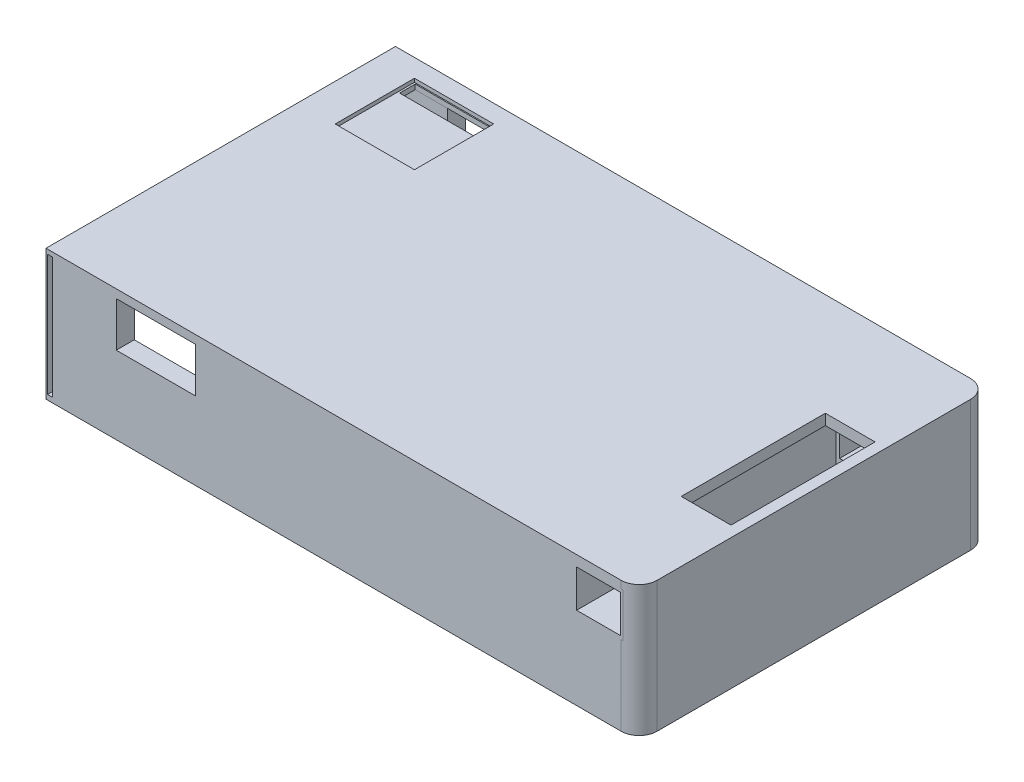
from build123d import *
from build123d.topology import SkipClean

# Parameters (mm, degrees)
CROQUIS1_W              = 114
CROQUIS1_H              = 34.2
SALIENTE_EXTRUIR1_DEPTH = 97
VACIADO1_T              = -5
SALIENTE_EXTRUIR2_DEPTH = 97
CORTAR_EXTRUIR1_REACH   = 128.031
CROQUIS3_W              = 13.814275766
CROQUIS3_H              = 40
REDONDEO2_R             = 5
CROQUIS6_W              = 12.3
CROQUIS6_H              = 10.4
CORTAR_EXTRUIR3_DEPTH   = 124.459670354
SALIENTE_EXTRUIR3_DEPTH = 97
CROQUIS8_W              = 13.814275766
CROQUIS8_H              = 40
CORTAR_EXTRUIR4_DEPTH   = 127.030661617
CROQUIS9_W              = 104
CROQUIS9_H              = 87
CORTAR_EXTRUIR5_DEPTH   = 10
CORTAR_EXTRUIR6_START   = -33.316303
CROQUIS11_W             = 1.5
CROQUIS11_H             = 39.999512223
CROQUIS11_H_2           = 40
CORTAR_EXTRUIR6_DEPTH   = 33.316303
CORTAR_EXTRUIR7_START   = -33.316303
CROQUIS13_W             = 15.314275766
CROQUIS13_H             = 4.5
CORTAR_EXTRUIR7_DEPTH   = 33.316303
CROQUIS14_W             = 40
CROQUIS14_H             = 2.980218128
SALIENTE_EXTRUIR4_DEPTH = 15.498885391
CORTAR_EXTRUIR8_DEPTH   = 20.498885391
CROQUIS19_W             = 5
CROQUIS19_H             = 21.536410229
CROQUIS19_H_2           = 2.349460024
SALIENTE_EXTRUIR5_DEPTH = 22
CROQUIS20_W             = 5
CROQUIS20_H             = 36.296521374
SALIENTE_EXTRUIR6_DEPTH = 19.5
CROQUIS21_W             = 87
CROQUIS21_H             = 2.349460024
SALIENTE_EXTRUIR7_DEPTH = 144.815390375
CROQUIS23_W             = 1.39816901
CROQUIS23_H             = 33.700902132
CORTAR_EXTRUIR9_DEPTH   = 95.5
CROQUIS24_W             = 22.493754325
CROQUIS24_H             = 22.211308676
CORTAR_EXTRUIR10_DEPTH  = 1.5
CROQUIS25_W             = 5.544572311
CROQUIS25_H             = 16.748281631
CORTAR_EXTRUIR11_DEPTH  = 1.5
SALIENTE_EXTRUIR8_DEPTH = 46
CROQUIS27_W             = 22
CROQUIS27_H             = 22
CORTAR_EXTRUIR12_DEPTH  = 1
CROQUIS28_W             = 21.106040847
CROQUIS28_H             = 4.330702007
CORTAR_EXTRUIR14_DEPTH  = 1.5


with BuildPart() as part:
    # Croquis1 → Saliente-Extruir1 (new body)
    with BuildSketch(Plane.XY):
        with Locations((0, -8.9)):
            Rectangle(CROQUIS1_W, CROQUIS1_H)
    extrude(amount=-SALIENTE_EXTRUIR1_DEPTH)

    # Vaciado1
    vaciado1_openings = [part.faces().sort_by_distance(p)[0] for p in [
        (0, -26, -48.5),
    ]]
    offset(amount=VACIADO1_T, openings=vaciado1_openings, kind=Kind.INTERSECTION)

    # Croquis2 → Saliente-Extruir2 (add, through all)
    with BuildSketch(Plane(origin=(0, 0, -97), x_dir=(-1, 0, 0), z_dir=(0, 0, -1))):
        Polygon((71.814275766, 8.2), (67.33466189, 8.2), (67.33466189, -3.967393508), (57, -3.967393508), (57, -26), (67.33466189, -26), (71.814275766, -26), align=None)
        Polygon((-57, 8.2), (57, 8.2), (67.33466189, 8.2), (71.814275766, 8.2), (71.814275766, 10.296521374), (-71.814275766, 10.296521374), (-71.814275766, 8.2), (-67.33466189, 8.2), align=None)
        Polygon((-67.33466189, -3.967393508), (-67.33466189, 8.2), (-71.814275766, 8.2), (-71.814275766, -26), (-67.33466189, -26), (-57, -26), (-57, -3.967393508), align=None)
    extrude(amount=-SALIENTE_EXTRUIR2_DEPTH)

    # Croquis3 → Cortar-Extruir1 (cut, up to next)
    with BuildSketch(Plane.XZ.offset(26), mode=Mode.PRIVATE) as cortar_extruir1_sk1:
        with Locations((-61.907137883, -48.5)):
            Rectangle(CROQUIS3_W, CROQUIS3_H)
    cortar_extruir1_tool1 = extrude(cortar_extruir1_sk1.sketch, amount=-CORTAR_EXTRUIR1_REACH, mode=Mode.PRIVATE) & part.part
    # Croquis3 → Cortar-Extruir1 (cut, up to next)
    with BuildSketch(Plane.XZ.offset(26), mode=Mode.PRIVATE) as cortar_extruir1_sk2:
        with Locations((61.907137883, -48.5)):
            Rectangle(CROQUIS3_W, CROQUIS3_H)
    cortar_extruir1_tool2 = extrude(cortar_extruir1_sk2.sketch, amount=-CORTAR_EXTRUIR1_REACH, mode=Mode.PRIVATE) & part.part
    add(cortar_extruir1_tool1.solids().sort_by_distance((-61.907138, -26, -48.5))[0], mode=Mode.SUBTRACT)
    add(cortar_extruir1_tool2.solids().sort_by_distance((61.907138, -26, -48.5))[0], mode=Mode.SUBTRACT)

    # Redondeo2
    # the kernel refuses this fillet: 5 mm, written as the material it takes off along each edge
    with BuildSketch(Plane(origin=(71.814275766, -38.5, -97), x_dir=(0, 0, 1), z_dir=(0, 1, 0)), Plane(origin=(71.814275766, -38.5, 0), x_dir=(-1, 0, 0), z_dir=(0, 1, 0)), Plane(origin=(-71.814275766, 22.796521374, -97), x_dir=(0, 0, 1), z_dir=(0, -1, 0)), Plane(origin=(-71.814275766, 22.796521374, 0), x_dir=(1, 0, 0), z_dir=(0, -1, 0))) as redondeo2_piece_1:
        with BuildLine():
            CenterArc((REDONDEO2_R, -REDONDEO2_R), REDONDEO2_R, 90, 90)
            Line((0, -REDONDEO2_R), (0, 0))
            Line((0, 0), (REDONDEO2_R, 0))
        make_face()
    extrude(amount=61.296521374, mode=Mode.SUBTRACT)

    # Croquis6 → Cortar-Extruir3 (cut, through all)
    with BuildSketch(Plane(origin=(0, 0, -97), x_dir=(-1, 0, 0), z_dir=(0, 0, -1))):
        with Locations((-60.617330945, 2.116303246)):
            Rectangle(CROQUIS6_W, CROQUIS6_H)
        with Locations((60.617330945, 2.116303246)):
            Rectangle(CROQUIS6_W, CROQUIS6_H)
    extrude(amount=-CORTAR_EXTRUIR3_DEPTH, mode=Mode.SUBTRACT)

    # Croquis7 → Saliente-Extruir3 (add, through all)
    with BuildSketch(Plane(origin=(0, 0, -97), x_dir=(-1, 0, 0), z_dir=(0, 0, -1))):
        Polygon((57, 8.2), (57, 7.316303246), (66.667330945, 7.316303246), (66.667330945, -3.083696754), (57, -3.083696754), (57, -3.967393508), (66.814275766, -3.967393508), (67.33466189, -3.967393508), (67.33466189, 8.2), (66.814275766, 8.2), align=None)
        Polygon((-66.667330945, 7.32503221), (-57, 7.32503221), (-57, 8.2), (-66.814275766, 8.2), (-67.33466189, 8.2), (-67.33466189, -3.967393508), (-66.814275766, -3.967393508), (-57, -3.967393508), (-57, -3.083696754), (-66.667330945, -3.083696754), align=None)
    extrude(amount=-SALIENTE_EXTRUIR3_DEPTH)

    # Croquis8 → Cortar-Extruir4 (cut, through all)
    with BuildSketch(Plane(origin=(0, 10.296521374, 0), x_dir=(1, 0, 0), z_dir=(0, 1, 0))):
        with Locations((-61.907137883, 48.5)):
            Rectangle(CROQUIS8_W, CROQUIS8_H)
        with Locations((61.907137883, 48.5)):
            Rectangle(CROQUIS8_W, CROQUIS8_H)
    extrude(amount=-CORTAR_EXTRUIR4_DEPTH, mode=Mode.SUBTRACT)

    # Croquis9 → Cortar-Extruir5 (cut)
    with BuildSketch(Plane.XZ.offset(-3.2)):
        with Locations((0, -48.5)):
            Rectangle(CROQUIS9_W, CROQUIS9_H)
    extrude(amount=-CORTAR_EXTRUIR5_DEPTH, mode=Mode.SUBTRACT)

    # Croquis11 → Cortar-Extruir6 (cut)
    with SkipClean():  # the faces are left unmerged after this step: merging them gives an invalid solid
        with BuildSketch(Plane.XZ.offset(26).offset(CORTAR_EXTRUIR6_START)):
            with Locations((54.25, -48.499756112)):
                Rectangle(CROQUIS11_W, CROQUIS11_H)
            with Locations((-54.25, -48.5)):
                Rectangle(CROQUIS11_W, CROQUIS11_H_2)
        extrude(amount=CORTAR_EXTRUIR6_DEPTH, mode=Mode.SUBTRACT)

    # Croquis13 → Cortar-Extruir7 (cut)
    with BuildSketch(Plane.XZ.offset(26).offset(CORTAR_EXTRUIR7_START)):
        with Locations((-61.157137883, -26.25)):
            Rectangle(CROQUIS13_W, CROQUIS13_H)
        with Locations((-61.157137883, -70.75)):
            Rectangle(CROQUIS13_W, CROQUIS13_H)
        with Locations((61.157137883, -26.25)):
            Rectangle(CROQUIS13_W, CROQUIS13_H)
        with Locations((61.157137883, -70.749512223)):
            Rectangle(CROQUIS13_W, CROQUIS13_H)
    extrude(amount=CORTAR_EXTRUIR7_DEPTH, mode=Mode.SUBTRACT)

    # Croquis14 → Saliente-Extruir4 (add)
    with BuildSketch(Plane.ZY.offset(55)):
        with Locations((-48.5, 8.80641231)):
            Rectangle(CROQUIS14_W, CROQUIS14_H)
    extrude(amount=SALIENTE_EXTRUIR4_DEPTH)

    # Croquis16 → Cortar-Extruir8 (cut)
    with BuildSketch(Plane.ZY.offset(71.814275766)):
        Polygon((-5, 10.296521374), (-98.41592061, 10.296521374), (-98.41592061, -27.13789471), (0, -27.13789471), (0, 10.296521374), align=None)
    extrude(amount=-CORTAR_EXTRUIR8_DEPTH, mode=Mode.SUBTRACT)

    # Croquis19 → Saliente-Extruir5 (add)
    with BuildSketch(Plane.ZY.offset(51.315390375)):
        with Locations((-2.5, -15.231794886)):
            Rectangle(CROQUIS19_W, CROQUIS19_H)
        with Locations((-94.5, -15.231794886)):
            Rectangle(CROQUIS19_W, CROQUIS19_H)
        with Locations((-2.5, 9.121791362)):
            Rectangle(CROQUIS19_W, CROQUIS19_H_2)
        with Locations((-94.5, 9.121791362)):
            Rectangle(CROQUIS19_W, CROQUIS19_H_2)
    extrude(amount=SALIENTE_EXTRUIR5_DEPTH)

    # Croquis20 → Saliente-Extruir6 (add)
    with BuildSketch(Plane.ZY.offset(73.315390375)):
        with Locations((-2.5, -7.851739313)):
            Rectangle(CROQUIS20_W, CROQUIS20_H)
        with Locations((-94.5, -7.851739313)):
            Rectangle(CROQUIS20_W, CROQUIS20_H)
    extrude(amount=SALIENTE_EXTRUIR6_DEPTH)

    # Croquis21 → Saliente-Extruir7 (add)
    with BuildSketch(Plane.ZY.offset(-52)):
        with Locations((-48.5, 9.121791362)):
            Rectangle(CROQUIS21_W, CROQUIS21_H)
    extrude(amount=SALIENTE_EXTRUIR7_DEPTH)

    # Croquis23 → Cortar-Extruir9 (cut)
    with BuildSketch(Plane.XY):
        with Locations((-91.682194084, -7.778032427)):
            Rectangle(CROQUIS23_W, CROQUIS23_H)
    extrude(amount=-CORTAR_EXTRUIR9_DEPTH, mode=Mode.SUBTRACT)

    # Croquis24 → Cortar-Extruir10 (cut)
    with BuildSketch(Plane(origin=(0, 10.296521374, 0), x_dir=(1, 0, 0), z_dir=(0, 1, 0))):
        with Locations((-78.515448222, 48.5)):
            Rectangle(CROQUIS24_W, CROQUIS24_H)
    extrude(amount=-CORTAR_EXTRUIR10_DEPTH, mode=Mode.SUBTRACT)

    # Croquis25 → Cortar-Extruir11 (cut)
    with BuildSketch(Plane(origin=(0, 8.796521374, 0), x_dir=(1, 0, 0), z_dir=(0, 1, 0))):
        with Locations((-86.990039229, 48.639589487)):
            Rectangle(CROQUIS25_W, CROQUIS25_H)
    extrude(amount=-CORTAR_EXTRUIR11_DEPTH, mode=Mode.SUBTRACT)

    # Croquis26 → Saliente-Extruir8 (add)
    with BuildSketch(Plane(origin=(-89.762325384, 0, 0), x_dir=(0, 0, -1), z_dir=(1, 0, 0))):
        Polygon((59.605654338, 10.296521374), (37.394345662, 10.296521374), (37.394345662, 8.796521374), (40.265448671, 8.796521374), (40.265448671, 7.94706135), (57.013730302, 7.94706135), (57.013730302, 8.796521374), (59.605654338, 8.796521374), align=None)
    extrude(amount=SALIENTE_EXTRUIR8_DEPTH)

    # Croquis27 → Cortar-Extruir12 (cut)
    with BuildSketch(Plane(origin=(0, 10.296521374, 0), x_dir=(1, 0, 0), z_dir=(0, 1, 0))):
        with Locations((-71.548762692, 81)):
            Rectangle(CROQUIS27_W, CROQUIS27_H)
    extrude(amount=-CORTAR_EXTRUIR12_DEPTH, mode=Mode.SUBTRACT)

    # Croquis28 → Cortar-Extruir14 (cut)
    with BuildSketch(Plane(origin=(0, 9.296521374, 0), x_dir=(1, 0, 0), z_dir=(0, 1, 0))):
        with Locations((-71.487233446, 89.534648997)):
            Rectangle(CROQUIS28_W, CROQUIS28_H)
    extrude(amount=-CORTAR_EXTRUIR14_DEPTH, mode=Mode.SUBTRACT)


solid = part.part
